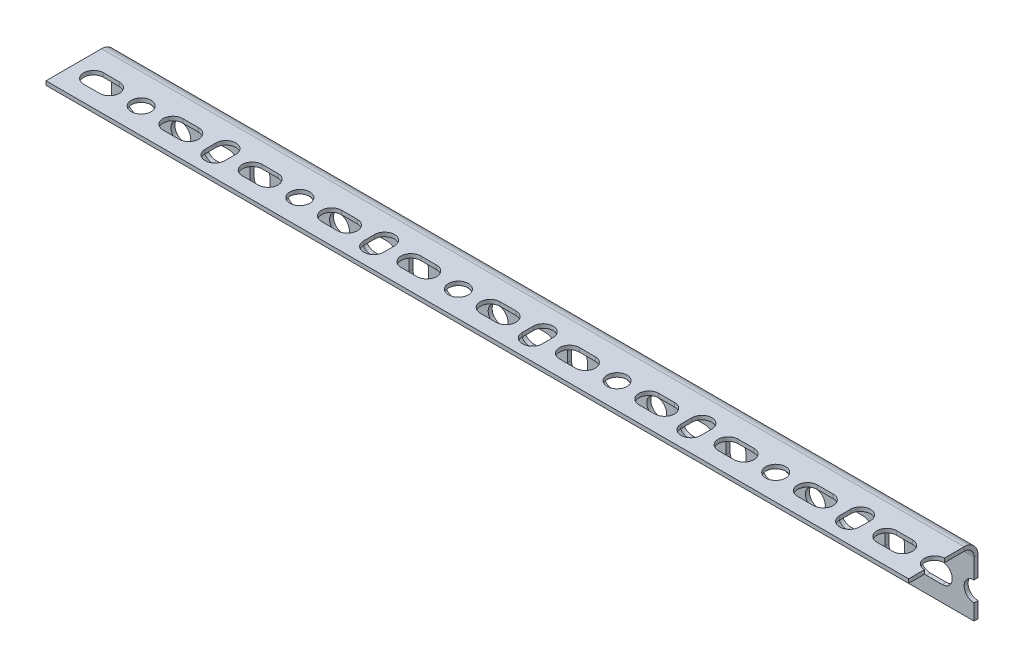
from build123d import *

# Parameters (mm, degrees)
SKETCH1_W                    = 435
SKETCH1_H                    = 2
BASE_FLANGE1_DEPTH           = 35
EDGE_FLANGE1_STRIP_W         = 18
EDGE_FLANGE1_STRIP_H         = 2
EDGE_FLANGE1_STRIP_CUT_DEPTH = 435
EDGE_FLANGE1_DEPTH           = 435
SKETCH11_R                   = 5
CUT_EXTRUDE1_DEPTH           = 224.061090287
LPATTERN1_COUNT              = 14
LPATTERN1_PITCH              = 80
SKETCH12_R                   = 5
CUT_EXTRUDE2_DEPTH           = 35
LPATTERN2_COUNT              = 15
LPATTERN2_PITCH              = 80


# Sheet-metal steps are written as plain solids
with BuildPart() as part:
    # Sketch1 → Base-Flange1 (new body)
    with BuildSketch(Plane(origin=(0, 0, 0), x_dir=(1, 0, 0), z_dir=(0, 1, 0))):
        with Locations((0, -1)):
            Rectangle(SKETCH1_W, SKETCH1_H)
    extrude(amount=BASE_FLANGE1_DEPTH)

    # Edge-Flange1 strip (across the edge) → Edge-Flange1 strip cut (cut)
    with BuildSketch(Plane(origin=(217.5, 35, 2), x_dir=(0, -1, 0), z_dir=(-1, 0, 0))):
        with Locations((-2, -1)):
            Rectangle(EDGE_FLANGE1_STRIP_W, EDGE_FLANGE1_STRIP_H)
    extrude(amount=EDGE_FLANGE1_STRIP_CUT_DEPTH, mode=Mode.SUBTRACT)

    # Edge-Flange1 section (across the edge) → Edge-Flange1 (add)
    with BuildSketch(Plane(origin=(217.5, 35, 2), x_dir=(0, -1, 0), z_dir=(-1, 0, 0))):
        with BuildLine():
            Line((0, 5), (0, 33))
            Line((0, 33), (2, 33))
            Line((2, 33), (2, 5))
            ThreePointArc((2, 5), (3.464466094, 1.464466094), (7, 0))
            Line((7, 0), (7, -2))
            ThreePointArc((7, -2), (2.050252532, 0.050252532), (0, 5))
        make_face()
    extrude(amount=EDGE_FLANGE1_DEPTH)

    # Sketch11 → Cut-Extrude1 (cut, through all)
    with BuildSketch(Plane(origin=(0, 35, 0), x_dir=(1, 0, 0), z_dir=(0, 1, 0))):
        with Locations((217.5, -22)):
            Circle(SKETCH11_R)
        with BuildLine():
            Line((201.5, -27), (193.5, -27))
            ThreePointArc((193.5, -27), (188.5, -22), (193.5, -17))
            Line((193.5, -17), (201.5, -17))
            ThreePointArc((201.5, -17), (206.5, -22), (201.5, -27))
        make_face()
        with BuildLine():
            Line((161.5, -27), (153.5, -27))
            ThreePointArc((153.5, -27), (148.5, -22), (153.5, -17))
            Line((153.5, -17), (161.5, -17))
            ThreePointArc((161.5, -17), (166.5, -22), (161.5, -27))
        make_face()
        with BuildLine():
            Line((172.5, -24.75), (172.5, -19.25))
            ThreePointArc((172.5, -19.25), (177.5, -14.25), (182.5, -19.25))
            Line((182.5, -19.25), (182.5, -24.75))
            ThreePointArc((182.5, -24.75), (177.5, -29.75), (172.5, -24.75))
        make_face()
    cut_extrude1 = extrude(amount=-CUT_EXTRUDE1_DEPTH, mode=Mode.SUBTRACT)

    # LPattern1: Cut-Extrude1 ×14
    with Locations(*[(-i * LPATTERN1_PITCH, 0, 0) for i in range(1, LPATTERN1_COUNT)]):
        add(cut_extrude1, mode=Mode.SUBTRACT)

    # Sketch12 → Cut-Extrude2 (cut)
    with BuildSketch(Plane.XY.offset(2)):
        with Locations((217.5, 13)):
            Circle(SKETCH12_R)
        with BuildLine():
            Line((201.5, 8), (193.5, 8))
            ThreePointArc((193.5, 8), (188.5, 13), (193.5, 18))
            Line((193.5, 18), (201.5, 18))
            ThreePointArc((201.5, 18), (206.5, 13), (201.5, 8))
        make_face()
        with BuildLine():
            Line((172.5, 10.25), (172.5, 15.75))
            ThreePointArc((172.5, 15.75), (177.5, 20.75), (182.5, 15.75))
            Line((182.5, 15.75), (182.5, 10.25))
            ThreePointArc((182.5, 10.25), (177.5, 5.25), (172.5, 10.25))
        make_face()
        with BuildLine():
            Line((161.5, 8), (153.5, 8))
            ThreePointArc((153.5, 8), (148.5, 13), (153.5, 18))
            Line((153.5, 18), (161.5, 18))
            ThreePointArc((161.5, 18), (166.5, 13), (161.5, 8))
        make_face()
    cut_extrude2 = extrude(amount=-CUT_EXTRUDE2_DEPTH, mode=Mode.SUBTRACT)

    # LPattern2: Cut-Extrude2 ×15
    with Locations(*[(-i * LPATTERN2_PITCH, 0, 0) for i in range(1, LPATTERN2_COUNT)]):
        add(cut_extrude2, mode=Mode.SUBTRACT)


solid = part.part
